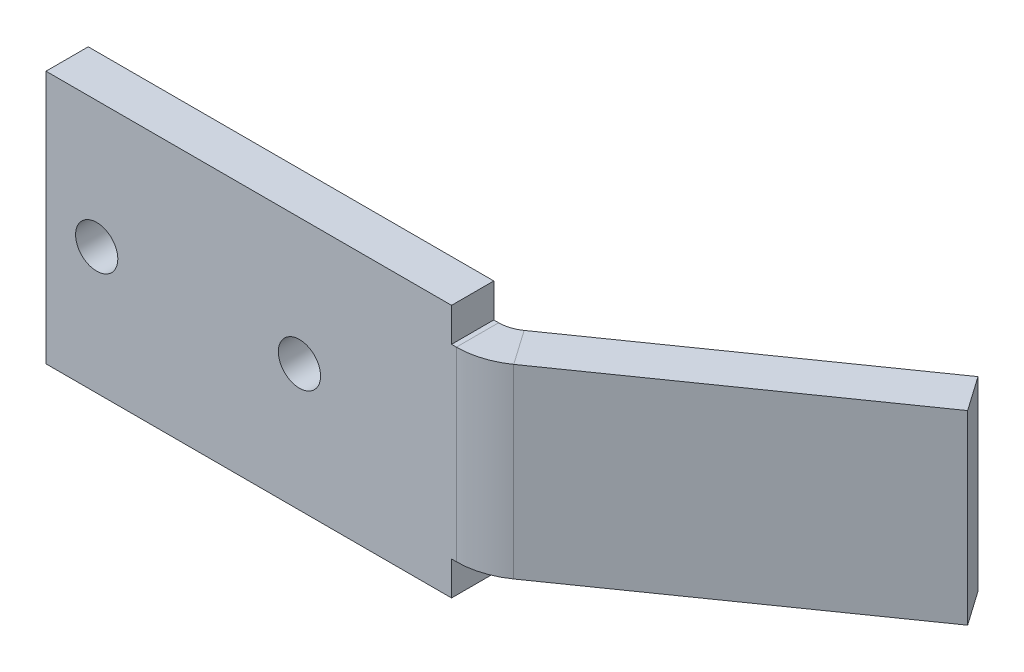
from build123d import *

# Parameters (mm, degrees)
SM_BASE_FLANGE_1_DEPTH = 2.5
HOLE_WIZARD_M31_D      = 2.5
HOLE_WIZARD_M31_DEPTH  = 8.5
HOLE_WIZARD_M31_TIP    = 0.751075774
OTHER_START            = 2
OTHER_1_DEPTH          = 11
OTHER_1_2_DEPTH        = 11


# Read off the part's stored shape, not the designer's step: Нарисованный сгиб1
# Sheet-metal steps are written as plain solids
with BuildPart() as part:
    # Sketch 1 → Базовая кромка1 (new body)
    with BuildSketch(Plane.XY):
        Polygon((24, 15), (24, 13), (44, 13), (44, 2), (24, 2), (24, 0), (0, 0), (0, 15), align=None)
    extrude(amount=-SM_BASE_FLANGE_1_DEPTH)

    # Отверстие обработанное метчиком M31
    with Locations(Plane.XY):
        with Locations((3, 7.5), (15, 7.5)):
            Hole(HOLE_WIZARD_M31_D / 2, depth=HOLE_WIZARD_M31_DEPTH)
            with Locations((0, 0, -(HOLE_WIZARD_M31_DEPTH + HOLE_WIZARD_M31_TIP / 2))):  # 118° drill point
                Cone(0, HOLE_WIZARD_M31_D / 2, HOLE_WIZARD_M31_TIP, mode=Mode.SUBTRACT)

    # Other 1 outline → Other 1 (cut)
    with BuildSketch(Plane(origin=(0, 0, 0), x_dir=(1, 0, 0), z_dir=(0, 1, 0)).offset(OTHER_START)):
        with BuildLine():
            Line((44, 2.5), (29.275370017, 2.5))
            Line((29.275370017, 2.5), (26.867249414, 0.813815801))
            ThreePointArc((26.867249414, 0.813815801), (25.639331548, 0.208273722), (24.28615545, 0))
            Line((24.28615545, 0), (44, 0))
            Line((44, 0), (44, 2.5))
        make_face()
    extrude(amount=OTHER_1_DEPTH, mode=Mode.SUBTRACT)

    # Other 1 2 outline → Other 1 2 (add)
    with BuildSketch(Plane(origin=(0, 0, 0), x_dir=(1, 0, 0), z_dir=(0, 1, 0)).offset(OTHER_START)):
        with BuildLine():
            Line((29.275370017, 2.5), (42.665543077, 11.875900115))
            Line((42.665543077, 11.875900115), (41.231601986, 13.923780225))
            Line((41.231601986, 13.923780225), (25.433308323, 2.861695911))
            ThreePointArc((25.433308323, 2.861695911), (24.887567049, 2.592566099), (24.28615545, 2.5))
            Line((24.28615545, 2.5), (29.275370017, 2.5))
        make_face()
    extrude(amount=OTHER_1_2_DEPTH)


solid = part.part
